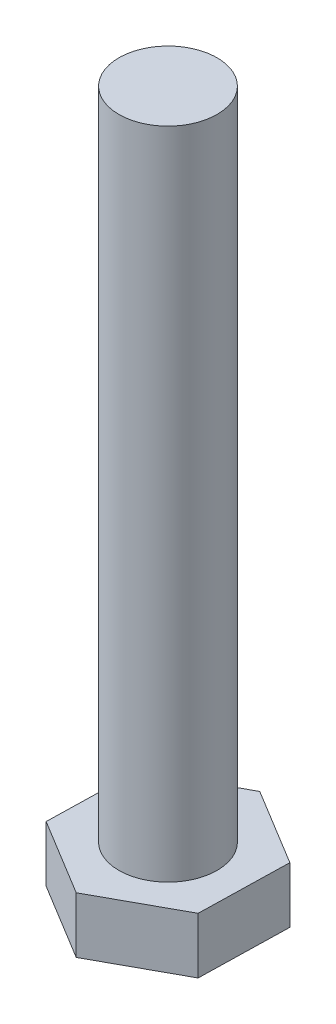
from build123d import *

# Parameters (mm, degrees)
EXTRUDE_1_DEPTH = 8
SKETCH_2_R      = 6
EXTRUDE_2_DEPTH = 80
CHAMFER_1_SIZE  = 2
CHAMFER_1_SIZE2 = 1.154700538


with BuildPart() as part:
    # Эскиз1 → Бобышка-Вытянуть1 (new body)
    with BuildSketch(Plane(origin=(0, 0, 0), x_dir=(1, 0, 0), z_dir=(0, 1, 0))):
        Polygon((9.374335606, -5.696943503), (9.620865601, 5.269941027), (0.246529995, 10.96688453), (-9.374335606, 5.696943503), (-9.620865601, -5.269941027), (-0.246529995, -10.96688453), align=None)
    extrude(amount=EXTRUDE_1_DEPTH)

    # Эскиз2 → Бобышка-Вытянуть2 (add)
    with BuildSketch(Plane(origin=(0, 8, 0), x_dir=(1, 0, 0), z_dir=(0, 1, 0))):
        Circle(SKETCH_2_R)
    extrude(amount=EXTRUDE_2_DEPTH)

    # Фаска1
    chamfer_1_edges = [part.edges().sort_by_distance(p)[0] for p in [
        (4.933697798, 0, -8.118412778),
        (9.497600603, 0, 0.213501238),
        (4.563902806, 0, 8.331914017),
        (-4.933697798, 0, 8.118412778),
        (-9.497600603, 0, -0.213501238),
        (-4.563902806, 0, -8.331914017),
    ]]
    chamfer_1_side = [part.faces().sort_by_distance(p)[0] for p in [
        (0, 0, 0),
    ]]
    chamfer(chamfer_1_edges, length=CHAMFER_1_SIZE, length2=CHAMFER_1_SIZE2, reference=chamfer_1_side[0])


solid = part.part
